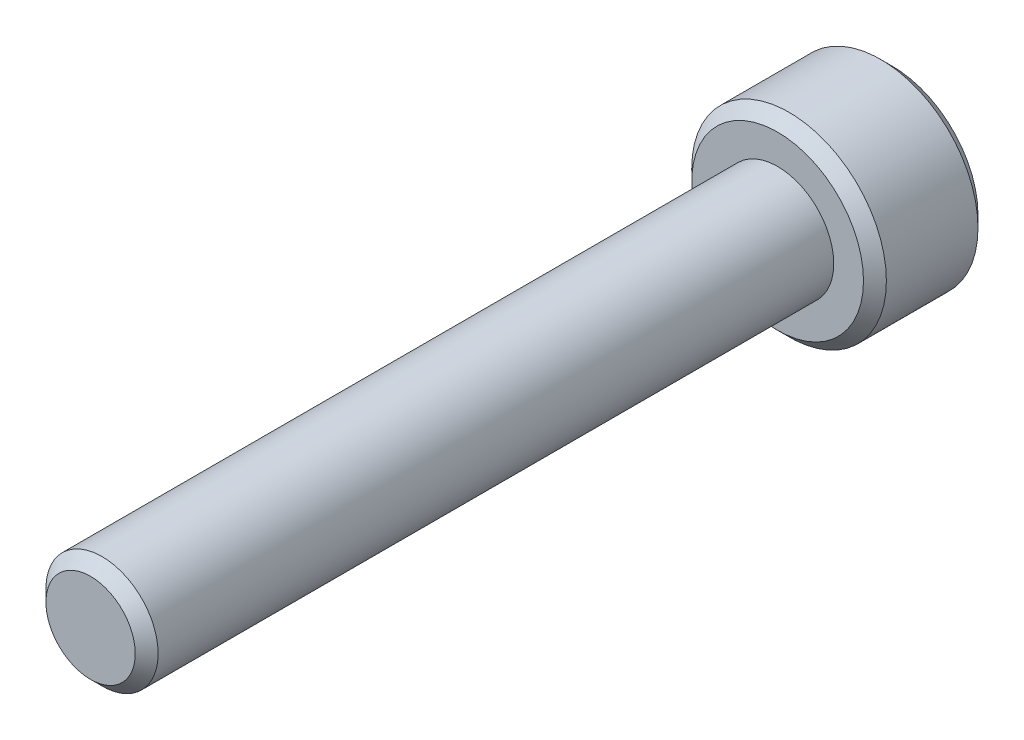
from build123d import *

# Parameters (mm, degrees)
SKIZZE1_R                       = 4.25
AUFSATZ_LINEAR_AUSTRAGEN1_DEPTH = 5
SKIZZE1_3_R                     = 2.45
AUFSATZ_LINEAR_AUSTRAGEN2_DEPTH = 35
FASE1_SIZE                      = 0.5


with BuildPart() as part:
    # Skizze1 → Aufsatz-Linear austragen1 (new body)
    with BuildSketch(Plane.XY):
        Circle(SKIZZE1_R)
    extrude(amount=AUFSATZ_LINEAR_AUSTRAGEN1_DEPTH)

    # Skizze1<3> → Aufsatz-Linear austragen2 (add)
    with BuildSketch(Plane.XY):
        Circle(SKIZZE1_3_R)
    extrude(amount=AUFSATZ_LINEAR_AUSTRAGEN2_DEPTH)

    # Fase1
    fase1_edges = [part.edges().sort_by_distance(p)[0] for p in [
        (-4.25, 0, 0),
        (-4.25, 0, 5),
        (-2.45, 0, 35),
    ]]
    chamfer(fase1_edges, length=FASE1_SIZE)


solid = part.part
